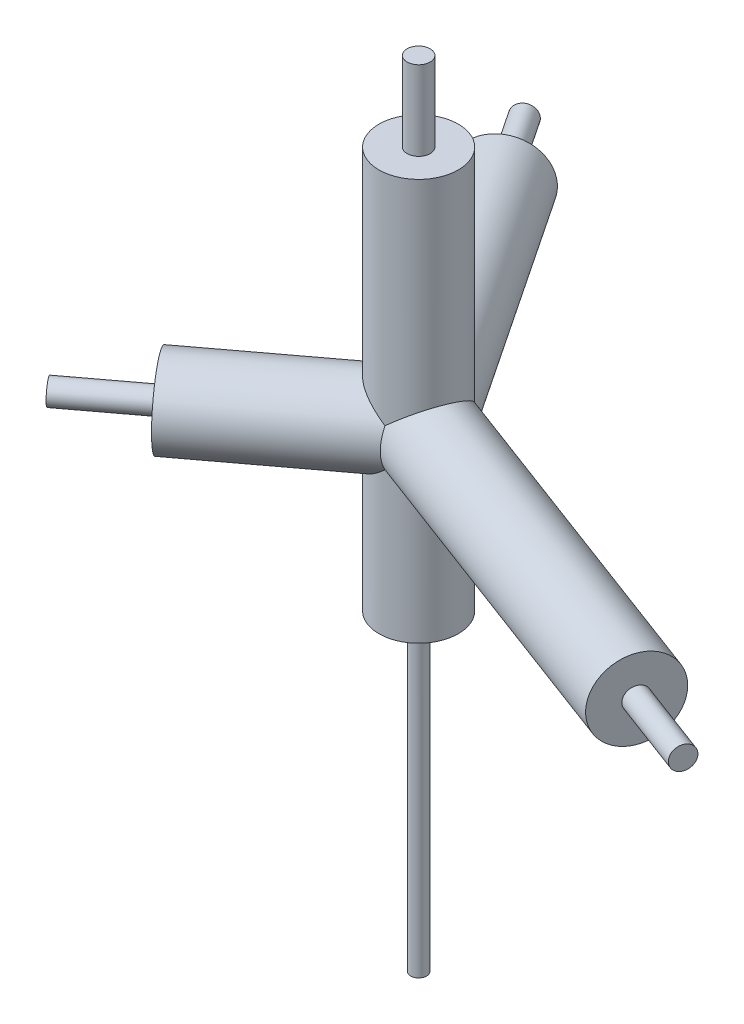
from build123d import *

# Parameters (mm, degrees)
SKETCH_3_R           = 5
SKETCH_4_R           = 5
SKETCH_2_R           = 5
SKETCH_7_R           = 5
SKETCH_7_R_2         = 1.45
CUT_EXTRUDE_1_DEPTH  = 10
SKETCH_8_R           = 5
SKETCH_8_R_2         = 1.45
CUT_EXTRUDE_2_DEPTH  = 10
SKETCH_9_R           = 5
SKETCH_9_R_2         = 1.45
CUT_EXTRUDE_3_DEPTH  = 10
EXTRUDE_1_DEPTH      = 40
EXTRUDE_1_DEPTH_BACK = 60
SKETCH_10_R          = 5
SKETCH_12_R          = 5
SKETCH_12_R_2        = 1.45
CUT_EXTRUDE_5_DEPTH  = 10


with BuildPart() as part:
    # 扫描1: sweep along a path in 草图1
    with BuildLine(Plane(origin=(0, 0, 0), x_dir=(1, 0, 0), z_dir=(0, 1, 0))) as sweep_1_path:
        Line((0, 0), (53.333333333, -20))
    # 草图3 → 扫描1 (sweep)
    with BuildSketch(Plane(origin=(0, 0, 0), x_dir=(0.35112344158838826, 0, -0.9363291775690458), z_dir=(0.9363291775690458, 0, 0.35112344158838826))):
        Circle(SKETCH_3_R)
    sweep(path=sweep_1_path.line)

    # 扫描7: sweep along a path in 草图5
    with BuildLine(Plane(origin=(0, 0, 0), x_dir=(1, 0, 0), z_dir=(0, 1, 0))) as sweep_7_path:
        Line((0, 0), (-26.666666667, 40))
    # 草图4 → 扫描7 (sweep)
    with BuildSketch(Plane(origin=(0, 0, 0), x_dir=(0.8320502943378456, 0, -0.5547001962252264), z_dir=(0.5547001962252264, 0, 0.8320502943378456))):
        Circle(SKETCH_4_R)
    sweep(path=sweep_7_path.line)

    # 扫描8: sweep along a path in 草图6
    with BuildLine(Plane(origin=(0, 0, 0), x_dir=(1, 0, 0), z_dir=(0, 1, 0))) as sweep_8_path:
        Line((0, 0), (-26.666666667, -20))
    # 草图2 → 扫描8 (sweep)
    with BuildSketch(Plane(origin=(0, 0, 0), x_dir=(0.600000000000003, 0, 0.7999999999999979), z_dir=(-0.7999999999999979, 0, 0.600000000000003))):
        Circle(SKETCH_2_R)
    sweep(path=sweep_8_path.line)

    # 草图7 → 切除-拉伸1 (cut)
    with BuildSketch(Plane(origin=(-26.666666667, 0, -40), x_dir=(-0.8320502943378455, 0, 0.5547001962252265), z_dir=(-0.5547001962252265, 0, -0.8320502943378456))):
        Circle(SKETCH_7_R)
        Circle(SKETCH_7_R_2, mode=Mode.SUBTRACT)
    extrude(amount=-CUT_EXTRUDE_1_DEPTH, mode=Mode.SUBTRACT)

    # 草图8 → 切除-拉伸2 (cut)
    with BuildSketch(Plane(origin=(-26.666666667, 0, 20), x_dir=(0.6000000000000031, 0, 0.7999999999999977), z_dir=(-0.7999999999999977, 0, 0.6000000000000031))):
        Circle(SKETCH_8_R)
        Circle(SKETCH_8_R_2, mode=Mode.SUBTRACT)
    extrude(amount=-CUT_EXTRUDE_2_DEPTH, mode=Mode.SUBTRACT)

    # 草图9 → 切除-拉伸3 (cut)
    with BuildSketch(Plane(origin=(53.333333333, 0, 20), x_dir=(0.35112344158838826, 0, -0.9363291775690458), z_dir=(0.9363291775690458, 0, 0.35112344158838826))):
        Circle(SKETCH_9_R)
        Circle(SKETCH_9_R_2, mode=Mode.SUBTRACT)
    extrude(amount=-CUT_EXTRUDE_3_DEPTH, mode=Mode.SUBTRACT)

    # 草图10 → 凸台-拉伸1 (add, two sides: drawn at the far end of the back side and taken through both)
    with BuildSketch(Plane(origin=(0, 0, 0), x_dir=(1, 0, 0), z_dir=(0, 1, 0)).offset(-EXTRUDE_1_DEPTH_BACK)):
        Circle(SKETCH_10_R)
    extrude(amount=EXTRUDE_1_DEPTH + EXTRUDE_1_DEPTH_BACK)

    # 草图12 → 切除-拉伸5 (cut)
    with BuildSketch(Plane(origin=(0, 40, 0), x_dir=(1, 0, 0), z_dir=(0, 1, 0))):
        Circle(SKETCH_12_R)
        Circle(SKETCH_12_R_2, mode=Mode.SUBTRACT)
    extrude(amount=-CUT_EXTRUDE_5_DEPTH, mode=Mode.SUBTRACT)

    # 草图13 → 切除-旋转1 (revolve, cut)
    with BuildSketch(Plane(origin=(0, 0, 0), x_dir=(0, 0, -1), z_dir=(1, 0, 0))):
        with BuildLine():
            ThreePointArc((-1, -20.025015645), (-19.897410745, -37.976872316), (-5, -59.364916731))
            Line((-5, -59.364916731), (-5, -60))
            Line((-5, -60), (-1, -60))
            Line((-1, -60), (-1, -20.025015645))
        make_face()
    revolve(axis=Axis((0, -1000, 0), (0, 1, 0)), mode=Mode.SUBTRACT)


solid = part.part
